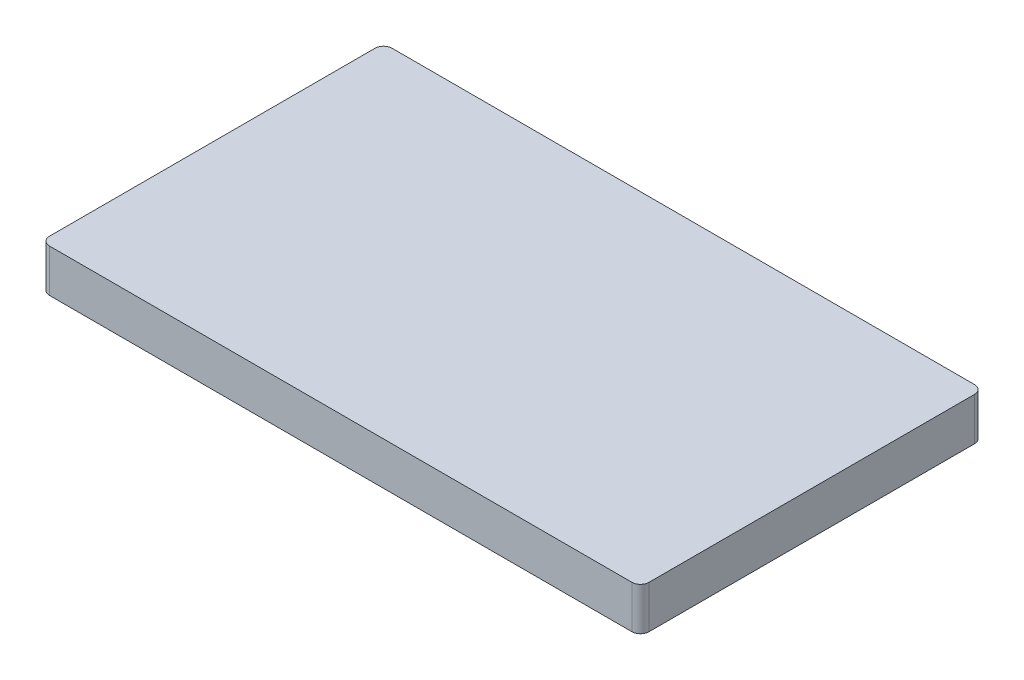
from build123d import *

# Parameters (mm, degrees)
SKETCH1_W           = 140
SKETCH1_H           = 80
BOSS_EXTRUDE1_DEPTH = 10
FILLET1_R           = 2


with BuildPart() as part:
    # Sketch1 → Boss-Extrude1 (new body)
    with BuildSketch(Plane(origin=(0, 0, 0), x_dir=(1, 0, 0), z_dir=(0, 1, 0))):
        Rectangle(SKETCH1_W, SKETCH1_H)
    extrude(amount=BOSS_EXTRUDE1_DEPTH)

    # Fillet1
    fillet1_edges = [part.edges().sort_by_distance(p)[0] for p in [
        (-70, 5, -40),
        (70, 5, -40),
        (70, 5, 40),
        (-70, 5, 40),
    ]]
    fillet(fillet1_edges, radius=FILLET1_R)


solid = part.part
